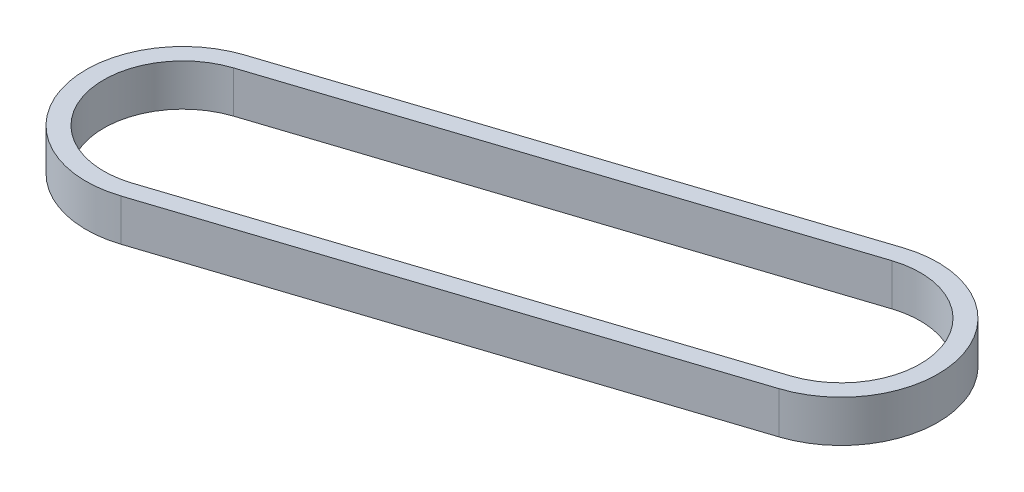
from build123d import *

# Parameters (mm, degrees)
CROQUIS42_R                        = 14.2875
CROQUIS42_R_2                      = 2.4892
CROQUIS42_R_3                      = 9.5631
EXTRUDE_4400_23_P_0501_DEPTH       = 6.35
EXTRUDE_4400_23_P_0502_OUTLINE_R   = 14.2875
EXTRUDE_4400_23_P_0502_OUTLINE_R_2 = 2.4892
EXTRUDE_4400_23_P_0502_DEPTH       = 6.35
CROQUIS47_R                        = 2.4892
CORTAR_EXTRUIR1_DEPTH              = 392.719699627
CROQUIS48_W                        = 203.2
CROQUIS48_H                        = 25.4
SALIENTE_EXTRUIR4_DEPTH            = 25.4
VACIADO1_T                         = -3.175
CROQUIS49_W                        = 50.8
CROQUIS49_H                        = 25.4
SALIENTE_EXTRUIR5_DEPTH            = 152.4
VACIADO2_T                         = -3.175
CROQUIS50_R                        = 14.3129
CROQUIS50_R_2                      = 2.4892
CORTAR_EXTRUIR2_DEPTH              = 539.610187059
CROQUIS53_R                        = 2.4892
SALIENTE_EXTRUIR6_DEPTH            = 3.175
CROQUIS55_R                        = 2.4892
CORTAR_EXTRUIR3_DEPTH              = 28.575
CORTAR_EXTRUIR4_DEPTH              = 420.505185398
CORTAR_EXTRUIR4_DEPTH_BACK         = 420.505185398
CROQUIS56_R                        = 3.2639
CROQUIS57_W                        = 50.8762
CROQUIS57_H                        = 25.4762
CORTAR_EXTRUIR5_DEPTH              = 6.35
SALIENTE_EXTRUIR7_DEPTH            = 4.5
SALIENTE_EXTRUIR9_DEPTH            = 4.5


# Read off the part's stored shape, not the designer's step: 4400-23-P-0502
with BuildPart() as part:
    # Croquis42 → 4400-23-P-0501 (new body)
    with BuildSketch(Plane(origin=(0, 184.15, 0), x_dir=(1, 0, 0), z_dir=(0, 1, 0))):
        with BuildLine():
            Line((88.359188985, 137.182253519), (-88.34651861, 137.182253519))
            ThreePointArc((-88.34651861, 137.182253519), (-105.337250829, 130.662799557), (-113.605912458, 114.451152627))
            Line((-113.605912458, 114.451152627), (-139.101589768, -126.848847373))
            ThreePointArc((-139.101589768, -126.848847373), (-140.353519458, -135.509571637), (-142.264354165, -144.049137401))
            ThreePointArc((-142.264354165, -144.049137401), (-151.832193089, -152.899040942), (-164.816388377, -151.769878826))
            ThreePointArc((-164.816388377, -151.769878826), (-169.567285608, -151.859959078), (-171.875550605, -156.013397612))
            ThreePointArc((-171.875550605, -156.013397612), (-178.08501659, -181.1261948), (-195.856181675, -199.925017686))
            ThreePointArc((-195.856181675, -199.925017686), (-196.402455792, -200.320741342), (-196.887342109, -200.789674047))
            Line((-196.887342109, -200.789674047), (-212.697786669, -218.412409382))
            ThreePointArc((-212.697786669, -218.412409382), (-217.730973382, -222.727024179), (-223.709210874, -225.59225468))
            Line((-223.709210874, -225.59225468), (-235.835713977, -229.557877567))
            ThreePointArc((-235.835713977, -229.557877567), (-253.324996625, -262.868518564), (-220.522053125, -281.292435328))
            Line((-220.522053125, -281.292435328), (-112.095188672, -252.504801968))
            ThreePointArc((-112.095188672, -252.504801968), (-87.673300223, -225.175066373), (-103.110565757, -191.933015956))
            ThreePointArc((-103.110565757, -191.933015956), (-118.079867963, -174.552433995), (-120.357522092, -151.727514948))
            Line((-120.357522092, -151.727514948), (-112.383619234, -113.627514948))
            ThreePointArc((-112.383619234, -113.627514948), (-101.768716069, -96.213982816), (-82.55, -89.391356987))
            ThreePointArc((-82.55, -89.391356987), (-62.030318089, -81.335848201), (-52.471032559, -61.472096599))
            Line((-52.471032559, -61.472096599), (-47.621676919, 3.551545851))
            ThreePointArc((-47.621676919, 3.551545851), (0, 47.753927487), (47.621676919, 3.551545851))
            Line((47.621676919, 3.551545851), (52.471032559, -61.472096599))
            ThreePointArc((52.471032559, -61.472096599), (62.030318089, -81.335848201), (82.55, -89.391356987))
            ThreePointArc((82.55, -89.391356987), (101.768716069, -96.213982816), (112.383619234, -113.627514948))
            Line((112.383619234, -113.627514948), (120.357522092, -151.727514948))
            ThreePointArc((120.357522092, -151.727514948), (118.079867963, -174.552433995), (103.110565757, -191.933015956))
            ThreePointArc((103.110565757, -191.933015956), (87.673300223, -225.175066373), (112.095188672, -252.504801968))
            Line((112.095188672, -252.504801968), (220.522053125, -281.292435328))
            ThreePointArc((220.522053125, -281.292435328), (253.324996625, -262.868518564), (235.835713977, -229.557877567))
            Line((235.835713977, -229.557877567), (223.709210874, -225.59225468))
            ThreePointArc((223.709210874, -225.59225468), (217.730973382, -222.727024179), (212.697786669, -218.412409382))
            Line((212.697786669, -218.412409382), (196.887342109, -200.789674047))
            ThreePointArc((196.887342109, -200.789674047), (196.402455792, -200.320741342), (195.856181675, -199.925017686))
            ThreePointArc((195.856181675, -199.925017686), (178.08501659, -181.1261948), (171.875550605, -156.013397612))
            ThreePointArc((171.875550605, -156.013397612), (169.567285608, -151.859959078), (164.816388377, -151.769878826))
            ThreePointArc((164.816388377, -151.769878826), (152.26322842, -153.039859148), (142.647258285, -144.87115097))
            ThreePointArc((142.647258285, -144.87115097), (140.583371058, -135.914425081), (139.245830086, -126.820825503))
            Line((139.245830086, -126.820825503), (113.617107402, 114.465079877))
            ThreePointArc((113.617107402, 114.465079877), (105.344715331, 130.667483058), (88.359188985, 137.182253519))
        make_face()
        with Locations(Location((-227.447376581, -255.208627108, 0), (0, 0, 270))):
            Circle(CROQUIS42_R, mode=Mode.SUBTRACT)
        with Locations(Location((-193.342405236, -203.970055914, 0), (0, 0, 270))):
            Circle(CROQUIS42_R_2, mode=Mode.SUBTRACT)
        with Locations(Location((-120.65, -220.283627108, 0), (0, 0, 270))):
            Circle(CROQUIS42_R, mode=Mode.SUBTRACT)
        with Locations(Location((-167.113590003, -155.941721458, 0), (0, 0, 270))):
            Circle(CROQUIS42_R_2, mode=Mode.SUBTRACT)
        with Locations(Location((120.65, -220.283627108, 0), (0, 0, 270))):
            Circle(CROQUIS42_R, mode=Mode.SUBTRACT)
        with Locations(Location((227.447376581, -255.208627108, 0), (0, 0, 270))):
            Circle(CROQUIS42_R, mode=Mode.SUBTRACT)
        with Locations(Location((167.113590003, -155.941721458, 0), (0, 0, 270))):
            Circle(CROQUIS42_R_2, mode=Mode.SUBTRACT)
        with Locations(Location((-82.55, -59.228856987, 0), (0, 0, 270))):
            Circle(CROQUIS42_R, mode=Mode.SUBTRACT)
        with Locations(Location((-82.55, 29.266072697, 0), (0, 0, 270))):
            Circle(CROQUIS42_R_2, mode=Mode.SUBTRACT)
        with Locations(Location((-107.95, 54.666072697, 0), (0, 0, 270))):
            Circle(CROQUIS42_R_2, mode=Mode.SUBTRACT)
        with Locations(Location((-82.55, 54.666072697, 0), (0, 0, 270))):
            Circle(CROQUIS42_R_3, mode=Mode.SUBTRACT)
        with Locations(Location((-82.55, 80.066072697, 0), (0, 0, 270))):
            Circle(CROQUIS42_R_2, mode=Mode.SUBTRACT)
        with Locations(Location((-57.15, 54.666072697, 0), (0, 0, 270))):
            Circle(CROQUIS42_R_2, mode=Mode.SUBTRACT)
        with Locations(Location((82.55, -59.228856987, 0), (0, 0, 270))):
            Circle(CROQUIS42_R, mode=Mode.SUBTRACT)
        with Locations(Location((82.55, 29.266072697, 0), (0, 0, 270))):
            Circle(CROQUIS42_R_2, mode=Mode.SUBTRACT)
        with Locations(Location((57.15, 54.666072697, 0), (0, 0, 270))):
            Circle(CROQUIS42_R_2, mode=Mode.SUBTRACT)
        with Locations(Location((82.55, 54.666072697, 0), (0, 0, 270))):
            Circle(CROQUIS42_R_3, mode=Mode.SUBTRACT)
        with Locations(Location((107.95, 54.666072697, 0), (0, 0, 270))):
            Circle(CROQUIS42_R_2, mode=Mode.SUBTRACT)
        with Locations(Location((82.55, 80.066072697, 0), (0, 0, 270))):
            Circle(CROQUIS42_R_2, mode=Mode.SUBTRACT)
        with Locations(Location((193.342405236, -203.970055914, 0), (0, 0, 270))):
            Circle(CROQUIS42_R_2, mode=Mode.SUBTRACT)
    extrude(amount=EXTRUDE_4400_23_P_0501_DEPTH)


with BuildPart() as body_2:
    # 4400-23-P-0502 outline → 4400-23-P-0502 (new body)
    with BuildSketch(Plane(origin=(0, 95.25, 0), x_dir=(1, 0, 0), z_dir=(0, 1, 0))):
        with BuildLine():
            Line((-113.605912458, 114.451152627), (-139.101589768, -126.848847373))
            ThreePointArc((-139.101589768, -126.848847373), (-140.353519458, -135.509571637), (-142.264354165, -144.049137401))
            ThreePointArc((-142.264354165, -144.049137401), (-151.832193089, -152.899040942), (-164.816388377, -151.769878826))
            ThreePointArc((-164.816388377, -151.769878826), (-169.567285608, -151.859959078), (-171.875550605, -156.013397612))
            ThreePointArc((-171.875550605, -156.013397612), (-178.08501659, -181.1261948), (-195.856181675, -199.925017686))
            Line((-195.856181675, -199.925017686), (-212.697786669, -218.412409382))
            ThreePointArc((-212.697786669, -218.412409382), (-217.730973382, -222.727024179), (-223.709210874, -225.59225468))
            Line((-223.709210874, -225.59225468), (-235.835713977, -229.557877567))
            ThreePointArc((-235.835713977, -229.557877567), (-253.324996625, -262.868518564), (-220.522053125, -281.292435328))
            Line((-220.522053125, -281.292435328), (-112.095188672, -252.504801968))
            ThreePointArc((-112.095188672, -252.504801968), (-87.673300223, -225.175066373), (-103.110565757, -191.933015956))
            ThreePointArc((-103.110565757, -191.933015956), (-118.079867963, -174.552433995), (-120.357522092, -151.727514948))
            Line((-120.357522092, -151.727514948), (-112.383619234, -113.627514948))
            ThreePointArc((-112.383619234, -113.627514948), (-100.293200153, -90.736166152), (-77.899975527, -77.74634036))
            ThreePointArc((-77.899975527, -77.74634036), (-67.495099348, -70.970657719), (-63.457595278, -59.228856987))
            Line((-63.457595278, -59.228856987), (-63.457595278, 0))
            ThreePointArc((-63.457595278, 0), (0, 63.457595278), (63.457595278, 0))
            Line((63.457595278, 0), (63.457595278, -59.228856987))
            ThreePointArc((63.457595278, -59.228856987), (67.495099348, -70.970657719), (77.899975527, -77.74634036))
            ThreePointArc((77.899975527, -77.74634036), (100.293200153, -90.736166152), (112.383619234, -113.627514948))
            Line((112.383619234, -113.627514948), (120.357522092, -151.727514948))
            ThreePointArc((120.357522092, -151.727514948), (118.079867963, -174.552433995), (103.110565757, -191.933015956))
            ThreePointArc((103.110565757, -191.933015956), (87.673300223, -225.175066373), (112.095188672, -252.504801968))
            Line((112.095188672, -252.504801968), (220.522053125, -281.292435328))
            ThreePointArc((220.522053125, -281.292435328), (253.324996625, -262.868518564), (235.835713977, -229.557877567))
            Line((235.835713977, -229.557877567), (223.709210874, -225.59225468))
            ThreePointArc((223.709210874, -225.59225468), (217.730973382, -222.727024179), (212.697786669, -218.412409382))
            Line((212.697786669, -218.412409382), (195.856181675, -199.925017686))
            ThreePointArc((195.856181675, -199.925017686), (178.08501659, -181.1261948), (171.875550605, -156.013397612))
            ThreePointArc((171.875550605, -156.013397612), (169.567285608, -151.859959078), (164.816388377, -151.769878826))
            ThreePointArc((164.816388377, -151.769878826), (151.832193089, -152.899040942), (142.264354165, -144.049137401))
            ThreePointArc((142.264354165, -144.049137401), (140.353519458, -135.509571637), (139.101589768, -126.848847373))
            Line((139.101589768, -126.848847373), (113.605912458, 114.451152627))
            ThreePointArc((113.605912458, 114.451152627), (105.341959426, 130.658561195), (88.359188984, 137.182250359))
            Line((88.359188984, 137.182250359), (-88.34651861, 137.182253519))
            ThreePointArc((-88.34651861, 137.182253519), (-105.337250829, 130.662799557), (-113.605912458, 114.451152627))
        make_face()
        with Locations((-227.447376581, -255.208627108)):
            Circle(EXTRUDE_4400_23_P_0502_OUTLINE_R, mode=Mode.SUBTRACT)
        with Locations((-193.342405236, -203.970055914)):
            Circle(EXTRUDE_4400_23_P_0502_OUTLINE_R_2, mode=Mode.SUBTRACT)
        with Locations((-120.65, -220.283627108)):
            Circle(EXTRUDE_4400_23_P_0502_OUTLINE_R, mode=Mode.SUBTRACT)
        with Locations((-167.113590003, -155.941721458)):
            Circle(EXTRUDE_4400_23_P_0502_OUTLINE_R_2, mode=Mode.SUBTRACT)
        with Locations((120.65, -220.283627108)):
            Circle(EXTRUDE_4400_23_P_0502_OUTLINE_R, mode=Mode.SUBTRACT)
        with Locations((227.447376581, -255.208627108)):
            Circle(EXTRUDE_4400_23_P_0502_OUTLINE_R, mode=Mode.SUBTRACT)
        with Locations((193.342405236, -203.970055914)):
            Circle(EXTRUDE_4400_23_P_0502_OUTLINE_R_2, mode=Mode.SUBTRACT)
        with Locations((167.113590003, -155.941721458)):
            Circle(EXTRUDE_4400_23_P_0502_OUTLINE_R_2, mode=Mode.SUBTRACT)
        with Locations((-82.55, -59.228856987)):
            Circle(EXTRUDE_4400_23_P_0502_OUTLINE_R, mode=Mode.SUBTRACT)
        with Locations((82.55, -59.228856987)):
            Circle(EXTRUDE_4400_23_P_0502_OUTLINE_R, mode=Mode.SUBTRACT)
    extrude(amount=EXTRUDE_4400_23_P_0502_DEPTH)


with BuildPart() as cortar_extruir1_tool:
    # Croquis47 → Cortar-Extruir1 (new, through all)
    with BuildSketch(Plane(origin=(0, 190.5, 0), x_dir=(1, 0, 0), z_dir=(0, 1, 0))):
        with Locations(Location((-131.508664667, -129.403842106, 0), (0, 0, 270))):
            Circle(CROQUIS47_R)
        with Locations(Location((-191.907087884, -241.47917412, 0), (0, 0, 270))):
            Circle(CROQUIS47_R)
        with Locations(Location((131.508664667, -129.403842106, 0), (0, 0, 270))):
            Circle(CROQUIS47_R)
        with Locations(Location((-117.606595202, -5.496427303, 0), (0, 0, 270))):
            Circle(CROQUIS47_R)
        with Locations(Location((-116.361466228, 16.971143013, 0), (0, 0, 270))):
            Circle(CROQUIS47_R)
        with Locations(Location((116.361466228, 16.971143013, 0), (0, 0, 270))):
            Circle(CROQUIS47_R)
        with Locations(Location((117.606595202, -5.496427303, 0), (0, 0, 270))):
            Circle(CROQUIS47_R)
        with Locations(Location((38.8975, 62.847528811, 0), (0, 0, 270))):
            Circle(CROQUIS47_R)
        with Locations(Location((4.820590175, 80.776381017, 0), (0, 0, 270))):
            Circle(CROQUIS47_R)
        with Locations(Location((-37.776259667, 66.128159842, 0), (0, 0, 270))):
            Circle(CROQUIS47_R)
        with Locations(Location((-84.246357442, 7.676072697, 0), (0, 0, 270))):
            Circle(CROQUIS47_R)
        with Locations(Location((191.907087884, -241.47917412, 0), (0, 0, 270))):
            Circle(CROQUIS47_R)
        with Locations(Location((84.246357442, 7.676072697, 0), (0, 0, 270))):
            Circle(CROQUIS47_R)
    extrude(amount=-CORTAR_EXTRUIR1_DEPTH)


with BuildPart() as part_1:
    add(part.part)

    # Cortar-Extruir1: cut by cortar_extruir1_tool
    add(cortar_extruir1_tool.part, mode=Mode.SUBTRACT)


with BuildPart() as body_2_1:
    add(body_2.part)

    # Cortar-Extruir1: cut by cortar_extruir1_tool
    add(cortar_extruir1_tool.part, mode=Mode.SUBTRACT)


with BuildPart() as body_3:
    # Croquis48 → Saliente-Extruir4 (new body)
    with BuildSketch(Plane(origin=(0, 101.6, 0), x_dir=(1, 0, 0), z_dir=(0, 1, 0))):
        with Locations((0, 114.3)):
            Rectangle(CROQUIS48_W, CROQUIS48_H)
    extrude(amount=SALIENTE_EXTRUIR4_DEPTH)

    # Vaciado1
    vaciado1_openings = [body_3.faces().sort_by_distance(p)[0] for p in [
        (-101.6, 114.3, -114.3),
        (101.6, 114.3, -114.3),
    ]]
    offset(amount=VACIADO1_T, openings=vaciado1_openings, kind=Kind.INTERSECTION)


with BuildPart() as body_4:
    # Croquis49 → Saliente-Extruir5 (new body)
    with BuildSketch(Plane(origin=(0, 127, 0), x_dir=(1, 0, 0), z_dir=(0, 1, 0))):
        with Locations((0, 114.3)):
            Rectangle(CROQUIS49_W, CROQUIS49_H)
    extrude(amount=SALIENTE_EXTRUIR5_DEPTH)

    # Vaciado2
    vaciado2_openings = [body_4.faces().sort_by_distance(p)[0] for p in [
        (0, 279.4, -114.3),
        (0, 127, -114.3),
    ]]
    offset(amount=VACIADO2_T, openings=vaciado2_openings, kind=Kind.INTERSECTION)

    # Croquis50 → Cortar-Extruir2 (cut, through all)
    with BuildSketch(Plane.XY.offset(-101.6)):
        with Locations((0, 241.2619)):
            Circle(CROQUIS50_R)
        with Locations((11.90625, 261.884129928)):
            Circle(CROQUIS50_R_2)
        with Locations((11.90625, 220.639670072)):
            Circle(CROQUIS50_R_2)
        with Locations((-11.90625, 220.639670072)):
            Circle(CROQUIS50_R_2)
        with Locations((-11.90625, 261.884129928)):
            Circle(CROQUIS50_R_2)
    extrude(amount=-CORTAR_EXTRUIR2_DEPTH, mode=Mode.SUBTRACT)


with BuildPart() as body_5:
    # Croquis53 → Saliente-Extruir6 (new body)
    with BuildSketch(Plane.XY.offset(-101.6)):
        with BuildLine():
            Line((50.8, 101.6), (-50.8, 101.6))
            ThreePointArc((-50.8, 101.6), (-55.290128061, 103.459871939), (-57.15, 107.95))
            Line((-57.15, 107.95), (-57.15, 125.348133557))
            ThreePointArc((-57.15, 125.348133557), (-56.945468654, 126.946793942), (-56.345050385, 128.44246971))
            Line((-56.345050385, 128.44246971), (-27.216776701, 180.640336153))
            ThreePointArc((-27.216776701, 180.640336153), (-24.886805275, 183.021926158), (-21.671726315, 183.896))
            Line((-21.671726315, 183.896), (21.671726315, 183.896))
            ThreePointArc((21.671726315, 183.896), (24.886805275, 183.021926158), (27.216776701, 180.640336153))
            Line((27.216776701, 180.640336153), (56.345050385, 128.44246971))
            ThreePointArc((56.345050385, 128.44246971), (56.945468654, 126.946793942), (57.15, 125.348133557))
            Line((57.15, 125.348133557), (57.15, 107.95))
            ThreePointArc((57.15, 107.95), (55.290128061, 103.459871939), (50.8, 101.6))
        make_face()
        with Locations((0, 114.3)):
            Circle(CROQUIS53_R, mode=Mode.SUBTRACT)
        with Locations((12.7, 114.3)):
            Circle(CROQUIS53_R, mode=Mode.SUBTRACT)
        with Locations((25.4, 114.3)):
            Circle(CROQUIS53_R, mode=Mode.SUBTRACT)
        with Locations((38.1, 114.3)):
            Circle(CROQUIS53_R, mode=Mode.SUBTRACT)
        with Locations((50.8, 114.3)):
            Circle(CROQUIS53_R, mode=Mode.SUBTRACT)
        with Locations(Location((-50.8, 114.3, 0), (0, 0, 180))):
            Circle(CROQUIS53_R, mode=Mode.SUBTRACT)
        with Locations(Location((-38.1, 114.3, 0), (0, 0, 180))):
            Circle(CROQUIS53_R, mode=Mode.SUBTRACT)
        with Locations(Location((-25.4, 114.3, 0), (0, 0, 180))):
            Circle(CROQUIS53_R, mode=Mode.SUBTRACT)
        with Locations(Location((-12.7, 114.3, 0), (0, 0, 180))):
            Circle(CROQUIS53_R, mode=Mode.SUBTRACT)
        with Locations(Location((-12.7, 139.7, 0), (0, 0, 180))):
            Circle(CROQUIS53_R, mode=Mode.SUBTRACT)
        with Locations((12.7, 139.7)):
            Circle(CROQUIS53_R, mode=Mode.SUBTRACT)
        with Locations(Location((-12.7, 152.4, 0), (0, 0, 180))):
            Circle(CROQUIS53_R, mode=Mode.SUBTRACT)
        with Locations((12.7, 152.4)):
            Circle(CROQUIS53_R, mode=Mode.SUBTRACT)
        with Locations(Location((-12.7, 165.1, 0), (0, 0, 180))):
            Circle(CROQUIS53_R, mode=Mode.SUBTRACT)
        with Locations((12.7, 165.1)):
            Circle(CROQUIS53_R, mode=Mode.SUBTRACT)
        with Locations(Location((-12.7, 177.8, 0), (0, 0, 180))):
            Circle(CROQUIS53_R, mode=Mode.SUBTRACT)
        with Locations((12.7, 177.8)):
            Circle(CROQUIS53_R, mode=Mode.SUBTRACT)
    extrude(amount=SALIENTE_EXTRUIR6_DEPTH)


with BuildPart() as cortar_extruir3_tool:
    # Croquis55 → Cortar-Extruir3 (new body)
    with BuildSketch(Plane.XY.offset(-98.425)):
        with Locations(Location((-12.7, 114.3, 0), (0, 0, 180))):
            Circle(CROQUIS55_R)
        with Locations(Location((-12.7, 139.7, 0), (0, 0, 180))):
            Circle(CROQUIS55_R)
        with Locations(Location((-25.4, 114.3, 0), (0, 0, 180))):
            Circle(CROQUIS55_R)
        with Locations(Location((-38.1, 114.3, 0), (0, 0, 180))):
            Circle(CROQUIS55_R)
        with Locations(Location((-50.8, 114.3, 0), (0, 0, 180))):
            Circle(CROQUIS55_R)
        with Locations(Location((-12.7, 165.1, 0), (0, 0, 180))):
            Circle(CROQUIS55_R)
        with Locations(Location((-12.7, 152.4, 0), (0, 0, 180))):
            Circle(CROQUIS55_R)
        with Locations(Location((-12.7, 177.8, 0), (0, 0, 180))):
            Circle(CROQUIS55_R)
        with Locations((12.7, 165.1)):
            Circle(CROQUIS55_R)
        with Locations((12.7, 177.8)):
            Circle(CROQUIS55_R)
        with Locations((0, 114.3)):
            Circle(CROQUIS55_R)
        with Locations((12.7, 114.3)):
            Circle(CROQUIS55_R)
        with Locations((12.7, 139.7)):
            Circle(CROQUIS55_R)
        with Locations((12.7, 152.4)):
            Circle(CROQUIS55_R)
        with Locations((50.8, 114.3)):
            Circle(CROQUIS55_R)
        with Locations((38.1, 114.3)):
            Circle(CROQUIS55_R)
        with Locations((25.4, 114.3)):
            Circle(CROQUIS55_R)
    extrude(amount=-CORTAR_EXTRUIR3_DEPTH)


with BuildPart() as body_3_1:
    add(body_3.part)

    # Cortar-Extruir3: cut by cortar_extruir3_tool
    add(cortar_extruir3_tool.part, mode=Mode.SUBTRACT)


with BuildPart() as body_4_1:
    add(body_4.part)

    # Cortar-Extruir3: cut by cortar_extruir3_tool
    add(cortar_extruir3_tool.part, mode=Mode.SUBTRACT)


with BuildPart() as cortar_extruir4_tool:
    # Croquis56 → Cortar-Extruir4 (new, two sides: drawn at the far end of the back side and taken through both)
    with BuildSketch(Plane.XZ.offset(-101.6).offset(-CORTAR_EXTRUIR4_DEPTH_BACK)):
        with Locations(Location((-47.625, -114.3, 0), (0, 0, 90))):
            Circle(CROQUIS56_R)
        with Locations(Location((-79.375, -114.3, 0), (0, 0, 90))):
            Circle(CROQUIS56_R)
        with Locations(Location((79.375, -114.3, 0), (0, 0, 90))):
            Circle(CROQUIS56_R)
        with Locations(Location((47.625, -114.3, 0), (0, 0, 90))):
            Circle(CROQUIS56_R)
    extrude(amount=CORTAR_EXTRUIR4_DEPTH + CORTAR_EXTRUIR4_DEPTH_BACK)


with BuildPart() as part_2:
    add(part_1.part)

    # Cortar-Extruir4: cut by cortar_extruir4_tool
    add(cortar_extruir4_tool.part, mode=Mode.SUBTRACT)

    # Croquis57 → Cortar-Extruir5 (cut)
    with BuildSketch(Plane(origin=(0, 190.5, 0), x_dir=(1, 0, 0), z_dir=(0, 1, 0))):
        with Locations((0, 114.3)):
            Rectangle(CROQUIS57_W, CROQUIS57_H)
    extrude(amount=-CORTAR_EXTRUIR5_DEPTH, mode=Mode.SUBTRACT)


with BuildPart() as body_2_2:
    add(body_2_1.part)

    # Cortar-Extruir4: cut by cortar_extruir4_tool
    add(cortar_extruir4_tool.part, mode=Mode.SUBTRACT)


with BuildPart() as body_3_2:
    add(body_3_1.part)

    # Cortar-Extruir4: cut by cortar_extruir4_tool
    add(cortar_extruir4_tool.part, mode=Mode.SUBTRACT)


with BuildPart() as body_2_2_1:
    # Croquis11 → Saliente-Extruir7 (new, symmetric)
    with BuildSketch(Plane(origin=(0, 184.15, 0), x_dir=(1, 0, 0), z_dir=(0, 1, 0))):
        with BuildLine():
            Line((-109.07688548, -54.716778872), (-101.851570328, -12.238545402))
            ThreePointArc((-101.851570328, -12.238545402), (-103.966471358, -13.163959782), (-106.037145911, -14.184501326))
            Line((-106.037145911, -14.184501326), (-112.823079171, -54.079571818))
            ThreePointArc((-112.823079171, -54.079571818), (-112.569902429, -65.692595716), (-108.021298601, -76.380749238))
            Line((-108.021298601, -76.380749238), (-106.74780526, -70.997489991))
            ThreePointArc((-106.74780526, -70.997489991), (-109.186703086, -63.039441048), (-109.07688548, -54.716778872))
        make_face()
        with BuildLine():
            Line((-101.851570328, -12.238545402), (-95.105873566, 27.419971343))
            ThreePointArc((-95.105873566, 27.419971343), (-96.901921658, 28.321768859), (-98.633561075, 29.34179456))
            Line((-98.633561075, 29.34179456), (-106.037145911, -14.184501326))
            ThreePointArc((-106.037145911, -14.184501326), (-103.966471358, -13.163959782), (-101.851570328, -12.238545402))
        make_face()
        with BuildLine():
            ThreePointArc((-66.466438925, 29.34179456), (-68.198078342, 28.321768859), (-69.994126434, 27.419971343))
            Line((-69.994126434, 27.419971343), (-63.248429672, -12.238545402))
            ThreePointArc((-63.248429672, -12.238545402), (-61.133528642, -13.163959782), (-59.062854089, -14.184501326))
            Line((-59.062854089, -14.184501326), (-66.466438925, 29.34179456))
        make_face()
        with BuildLine():
            ThreePointArc((-59.062854089, -14.184501326), (-61.133528642, -13.163959782), (-63.248429672, -12.238545402))
            Line((-63.248429672, -12.238545402), (-56.02311452, -54.716778872))
            ThreePointArc((-56.02311452, -54.716778872), (-57.505982376, -69.069166098), (-66.190042872, -80.59205677))
            Line((-66.190042872, -80.59205677), (-67.463536214, -85.975316017))
            ThreePointArc((-67.463536214, -85.975316017), (-54.824440333, -72.429910028), (-52.276920829, -54.079571818))
            Line((-52.276920829, -54.079571818), (-59.062854089, -14.184501326))
        make_face()
        with BuildLine():
            Line((-95.105873566, 27.419971343), (-90.248720244, 55.975582898))
            ThreePointArc((-90.248720244, 55.975582898), (-82.55, 62.475369103), (-74.851279756, 55.975582898))
            Line((-74.851279756, 55.975582898), (-69.994126434, 27.419971343))
            ThreePointArc((-69.994126434, 27.419971343), (-68.198078342, 28.321768859), (-66.466438925, 29.34179456))
            Line((-66.466438925, 29.34179456), (-71.105086065, 56.612789952))
            ThreePointArc((-71.105086065, 56.612789952), (-82.55, 66.275369103), (-93.994913935, 56.612789952))
            Line((-93.994913935, 56.612789952), (-98.633561075, 29.34179456))
            ThreePointArc((-98.633561075, 29.34179456), (-96.901921658, 28.321768859), (-95.105873566, 27.419971343))
        make_face()
        with BuildLine():
            ThreePointArc((-70.763429712, -83.417930202), (-88.744505126, -85.414017067), (-103.925323363, -75.572970707))
            Line((-103.925323363, -75.572970707), (-105.012211918, -80.16742179))
            ThreePointArc((-105.012211918, -80.16742179), (-89.619308767, -89.111951435), (-71.850318266, -88.012381285))
            Line((-71.850318266, -88.012381285), (-70.763429712, -83.417930202))
        make_face()
        with BuildLine():
            ThreePointArc((-103.925323363, -75.572970707), (-105.451119385, -73.355896065), (-106.74780526, -70.997489991))
            Line((-106.74780526, -70.997489991), (-108.021298601, -76.380749238))
            ThreePointArc((-108.021298601, -76.380749238), (-106.591424249, -78.333421371), (-105.012211918, -80.16742179))
            Line((-105.012211918, -80.16742179), (-103.925323363, -75.572970707))
        make_face()
        with BuildLine():
            Line((-67.463536214, -85.975316017), (-66.190042872, -80.59205677))
            ThreePointArc((-66.190042872, -80.59205677), (-68.405985663, -82.119496135), (-70.763429712, -83.417930202))
            Line((-70.763429712, -83.417930202), (-71.850318266, -88.012381285))
            ThreePointArc((-71.850318266, -88.012381285), (-69.616758568, -87.080351135), (-67.463536214, -85.975316017))
        make_face()
    extrude(amount=SALIENTE_EXTRUIR7_DEPTH, both=True)


with BuildPart() as body_2_3:
    # Croquis61 → Saliente-Extruir9 (new, symmetric)
    with BuildSketch(Plane(origin=(0, 0, 0), x_dir=(1, 0, 0), z_dir=(0, 1, 0))):
        with BuildLine():
            Line((-114.172884767, -240.090038409), (-220.970261348, -275.015038409))
            ThreePointArc((-220.970261348, -275.015038409), (-247.253787883, -261.685742341), (-233.924491814, -235.402215806))
            Line((-233.924491814, -235.402215806), (-127.127115233, -200.477215806))
            ThreePointArc((-127.127115233, -200.477215806), (-100.843588699, -213.806511874), (-114.172884767, -240.090038409))
        make_face()
        with BuildLine():
            Line((-115.354012404, -236.478260799), (-222.151388985, -271.403260799))
            ThreePointArc((-222.151388985, -271.403260799), (-243.642010273, -260.504614704), (-232.743364177, -239.013993416))
            Line((-232.743364177, -239.013993416), (-125.945987596, -204.088993416))
            ThreePointArc((-125.945987596, -204.088993416), (-104.455366309, -214.987639511), (-115.354012404, -236.478260799))
        make_face(mode=Mode.SUBTRACT)
    extrude(amount=SALIENTE_EXTRUIR9_DEPTH, both=True)


solid = body_2_3.part
